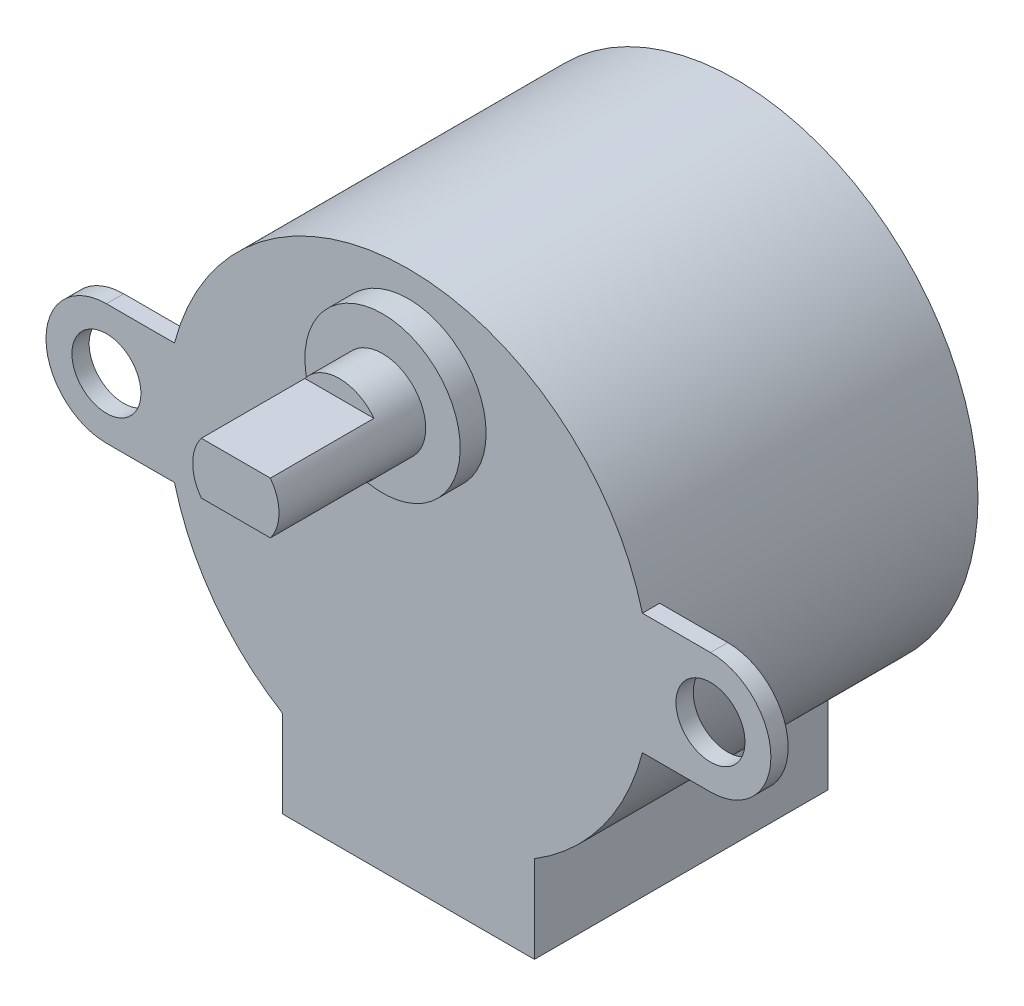
from build123d import *

# Parameters (mm, degrees)
BOSS_EXTRUDE1_DEPTH = 19
BOSS_EXTRUDE2_DEPTH = 17
CUT_EXTRUDE1_START  = -6
CUT_EXTRUDE1_DEPTH  = 6
SKETCH6_R           = 2
BOSS_EXTRUDE3_DEPTH = 1


with BuildPart() as part:
    # Sketch2 → Boss-Extrude1 (new body)
    with BuildSketch(Plane.XY):
        with BuildLine():
            ThreePointArc((14, 0), (-6.848357467, 12.210651088), (-7.3, -11.94612908))
            ThreePointArc((-7.3, -11.94612908), (0, -14), (7.3, -11.94612908))
            ThreePointArc((7.3, -11.94612908), (12.210651088, -6.848357467), (14, 0))
        make_face()
    extrude(amount=-BOSS_EXTRUDE1_DEPTH)

    # Sketch2<3> → Boss-Extrude2 (add)
    with BuildSketch(Plane.XY):
        with BuildLine():
            Line((-7.3, -11.94612908), (-7.3, -17))
            Line((-7.3, -17), (7.3, -17))
            Line((7.3, -17), (7.3, -11.94612908))
            ThreePointArc((7.3, -11.94612908), (0, -14), (-7.3, -11.94612908))
        make_face()
    extrude(amount=-BOSS_EXTRUDE2_DEPTH)

    # Sketch4 → Revolve1 (revolve)
    with BuildSketch(Plane(origin=(0, 0, 0), x_dir=(0, 0, -1), z_dir=(1, 0, 0))):
        Polygon((-10, 8), (-10, 10.5), (-1.5, 10.5), (-1.5, 12.5), (0, 12.5), (0, 8), align=None)
    revolve(axis=Axis((0, 8, 0), (0, 0, 1)))

    # Sketch5 → Cut-Extrude1 (cut)
    with BuildSketch(Plane.XY.offset(10).offset(CUT_EXTRUDE1_START)):
        with BuildLine():
            ThreePointArc((2, 9.5), (0, 10.5), (-2, 9.5))
            Line((-2, 9.5), (2, 9.5))
        make_face()
        with BuildLine():
            Line((2, 6.5), (-2, 6.5))
            ThreePointArc((-2, 6.5), (0, 5.5), (2, 6.5))
        make_face()
    extrude(amount=CUT_EXTRUDE1_DEPTH, mode=Mode.SUBTRACT)

    # Sketch6 → Boss-Extrude3 (add)
    # profile 1 of 2: a face of its own
    with BuildSketch(Plane.XY):
        with BuildLine():
            Line((-17.5, 3.5), (-13.555441712, 3.5))
            ThreePointArc((-13.555441712, 3.5), (-14, 0), (-13.555441712, -3.5))
            Line((-13.555441712, -3.5), (-17.5, -3.5))
            ThreePointArc((-17.5, -3.5), (-21, 0), (-17.5, 3.5))
        make_face()
        with Locations((-17.5, 0)):
            Circle(SKETCH6_R, mode=Mode.SUBTRACT)
    # profile 2 of 2: a face of its own
    with BuildSketch(Plane.XY):
        with BuildLine():
            Line((17.5, -3.5), (13.555441712, -3.5))
            ThreePointArc((13.555441712, -3.5), (14, 0), (13.555441712, 3.5))
            Line((13.555441712, 3.5), (17.5, 3.5))
            ThreePointArc((17.5, 3.5), (21, 0), (17.5, -3.5))
        make_face()
        with Locations((17.5, 0)):
            Circle(SKETCH6_R, mode=Mode.SUBTRACT)
    extrude(amount=-BOSS_EXTRUDE3_DEPTH)


solid = part.part
